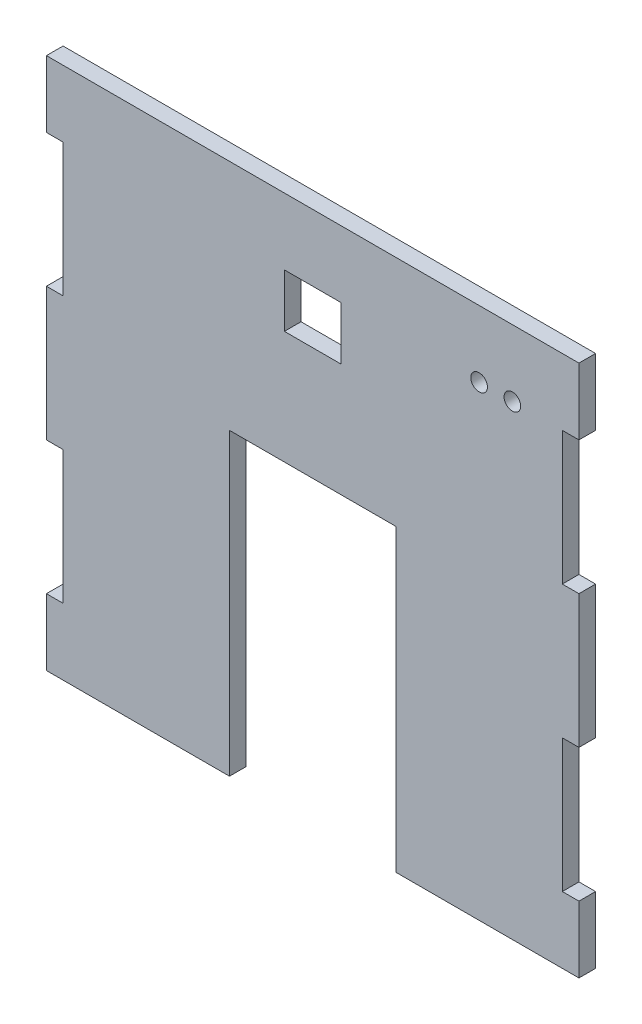
from build123d import *

# Parameters (mm, degrees)
SKETCH1_W           = 17
SKETCH1_H           = 16
SKETCH1_R           = 2.5
BOSS_EXTRUDE1_DEPTH = 5
SKETCH2_W           = 5
SKETCH2_H           = 40
CUT_EXTRUDE1_DEPTH  = 114.247516529


with BuildPart() as part:
    # Sketch1 → Boss-Extrude1 (new body)
    with BuildSketch(Plane.XY):
        Polygon((80, 80), (-80, 80), (-80, -80), (-25, -80), (-25, 10), (25, 10), (25, -80), (80, -80), align=None)
        with Locations((0, 52)):
            Rectangle(SKETCH1_W, SKETCH1_H, mode=Mode.SUBTRACT)
        with Locations((50, 60)):
            Circle(SKETCH1_R, mode=Mode.SUBTRACT)
        with Locations((60, 60)):
            Circle(SKETCH1_R, mode=Mode.SUBTRACT)
    extrude(amount=BOSS_EXTRUDE1_DEPTH)

    # Sketch2 → Cut-Extrude1 (cut, through all)
    with BuildSketch(Plane.XY.offset(5)):
        with Locations((-77.5, -40)):
            Rectangle(SKETCH2_W, SKETCH2_H)
        with Locations((-77.5, 40)):
            Rectangle(SKETCH2_W, SKETCH2_H)
        with Locations((77.5, 40)):
            Rectangle(SKETCH2_W, SKETCH2_H)
        with Locations((77.5, -40)):
            Rectangle(SKETCH2_W, SKETCH2_H)
    extrude(amount=-CUT_EXTRUDE1_DEPTH, mode=Mode.SUBTRACT)


solid = part.part
